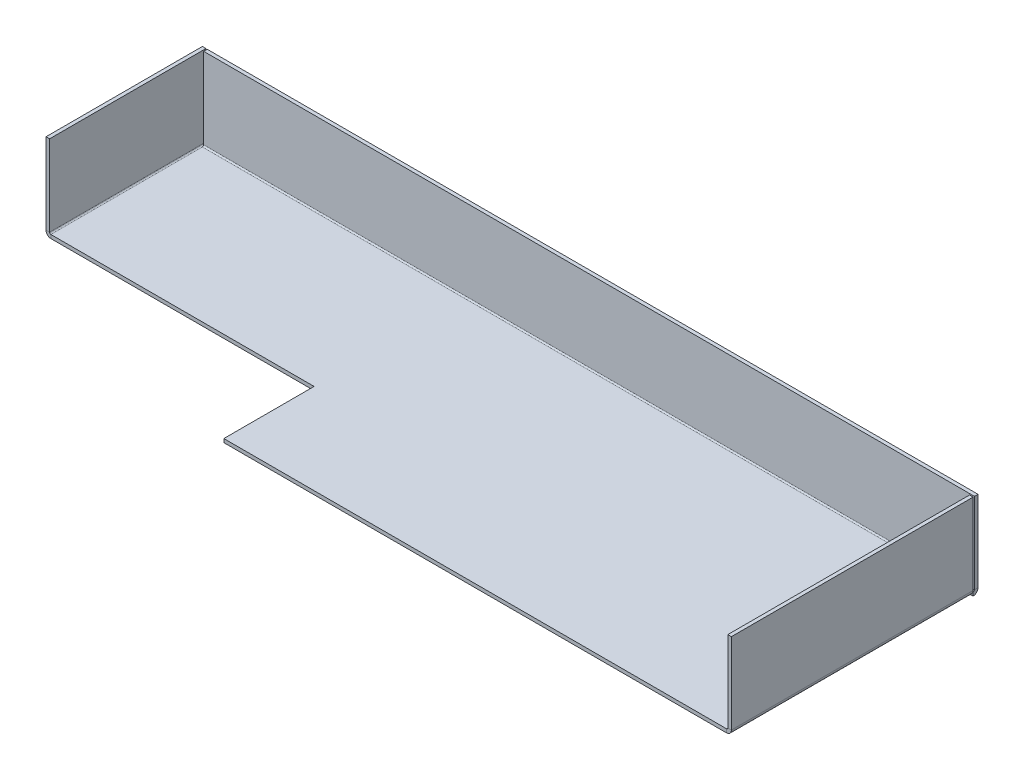
from build123d import *

# Parameters (mm, degrees)
BRIDA_BASE1_DEPTH                = 2
BRIDA_DE_ARISTA1_STRIP_W         = 9.4732
BRIDA_DE_ARISTA1_STRIP_H         = 2
BRIDA_DE_ARISTA1_STRIP_CUT_DEPTH = 87.5
BRIDA_DE_ARISTA1_DEPTH           = 87.5
BRIDA_DE_ARISTA2_STRIP_W         = 9.4732
BRIDA_DE_ARISTA2_STRIP_H         = 2
BRIDA_DE_ARISTA2_STRIP_CUT_DEPTH = 431.2634
BRIDA_DE_ARISTA2_DEPTH           = 431.2634
BRIDA_DE_ARISTA3_STRIP_W         = 9.4732
BRIDA_DE_ARISTA3_STRIP_H         = 2
BRIDA_DE_ARISTA3_STRIP_CUT_DEPTH = 135.2634
BRIDA_DE_ARISTA3_DEPTH           = 135.2634


# Sheet-metal steps are written as plain solids
with BuildPart() as part:
    # Croquis1 → Brida base1 (new body)
    with BuildSketch(Plane(origin=(0, 0, 0), x_dir=(1, 0, 0), z_dir=(0, 1, 0))):
        Polygon((-67, -69), (217, -69), (217, 69), (-217, 69), (-217, -18.5), (-67, -18.5), align=None)
    extrude(amount=-BRIDA_BASE1_DEPTH)

    # Brida de arista1 strip (across the edge) → Brida de arista1 strip cut (cut)
    with BuildSketch(Plane(origin=(-217, 0, -69), x_dir=(1, 0, 0), z_dir=(0, 0, 1))):
        with Locations((-2, -1)):
            Rectangle(BRIDA_DE_ARISTA1_STRIP_W, BRIDA_DE_ARISTA1_STRIP_H)
    extrude(amount=BRIDA_DE_ARISTA1_STRIP_CUT_DEPTH, mode=Mode.SUBTRACT)

    # Brida de arista1 section (across the edge) → Brida de arista1 (add)
    with BuildSketch(Plane(origin=(-217, 0, -69), x_dir=(1, 0, 0), z_dir=(0, 0, 1))):
        with BuildLine():
            Line((0, 0.7366), (0, 46))
            Line((0, 46), (2, 46))
            Line((2, 46), (2, 0.7366))
            ThreePointArc((2, 0.7366), (2.215745145, 0.215745145), (2.7366, 0))
            Line((2.7366, 0), (2.7366, -2))
            ThreePointArc((2.7366, -2), (0.801531583, -1.198468417), (0, 0.7366))
        make_face()
    extrude(amount=BRIDA_DE_ARISTA1_DEPTH)

    # Brida de arista2 strip (across the edge) → Brida de arista2 strip cut (cut)
    with BuildSketch(Plane(origin=(217, 0, -69), x_dir=(0, 0, 1), z_dir=(-1, 0, 0))):
        with Locations((-2, -1)):
            Rectangle(BRIDA_DE_ARISTA2_STRIP_W, BRIDA_DE_ARISTA2_STRIP_H)
    extrude(amount=BRIDA_DE_ARISTA2_STRIP_CUT_DEPTH, mode=Mode.SUBTRACT)

    # Brida de arista2 section (across the edge) → Brida de arista2 (add)
    with BuildSketch(Plane(origin=(217, 0, -69), x_dir=(0, 0, 1), z_dir=(-1, 0, 0))):
        with BuildLine():
            Line((0, 0.7366), (0, 46))
            Line((0, 46), (2, 46))
            Line((2, 46), (2, 0.7366))
            ThreePointArc((2, 0.7366), (2.215745145, 0.215745145), (2.7366, 0))
            Line((2.7366, 0), (2.7366, -2))
            ThreePointArc((2.7366, -2), (0.801531583, -1.198468417), (0, 0.7366))
        make_face()
    extrude(amount=BRIDA_DE_ARISTA2_DEPTH)

    # Brida de arista3 strip (across the edge) → Brida de arista3 strip cut (cut)
    with BuildSketch(Plane(origin=(217, 0, 69), x_dir=(-1, 0, 0), z_dir=(0, 0, -1))):
        with Locations((-2, -1)):
            Rectangle(BRIDA_DE_ARISTA3_STRIP_W, BRIDA_DE_ARISTA3_STRIP_H)
    extrude(amount=BRIDA_DE_ARISTA3_STRIP_CUT_DEPTH, mode=Mode.SUBTRACT)

    # Brida de arista3 section (across the edge) → Brida de arista3 (add)
    with BuildSketch(Plane(origin=(217, 0, 69), x_dir=(-1, 0, 0), z_dir=(0, 0, -1))):
        with BuildLine():
            Line((0, 0.7366), (0, 46))
            Line((0, 46), (2, 46))
            Line((2, 46), (2, 0.7366))
            ThreePointArc((2, 0.7366), (2.215745145, 0.215745145), (2.7366, 0))
            Line((2.7366, 0), (2.7366, -2))
            ThreePointArc((2.7366, -2), (0.801531583, -1.198468417), (0, 0.7366))
        make_face()
    extrude(amount=BRIDA_DE_ARISTA3_DEPTH)


solid = part.part
